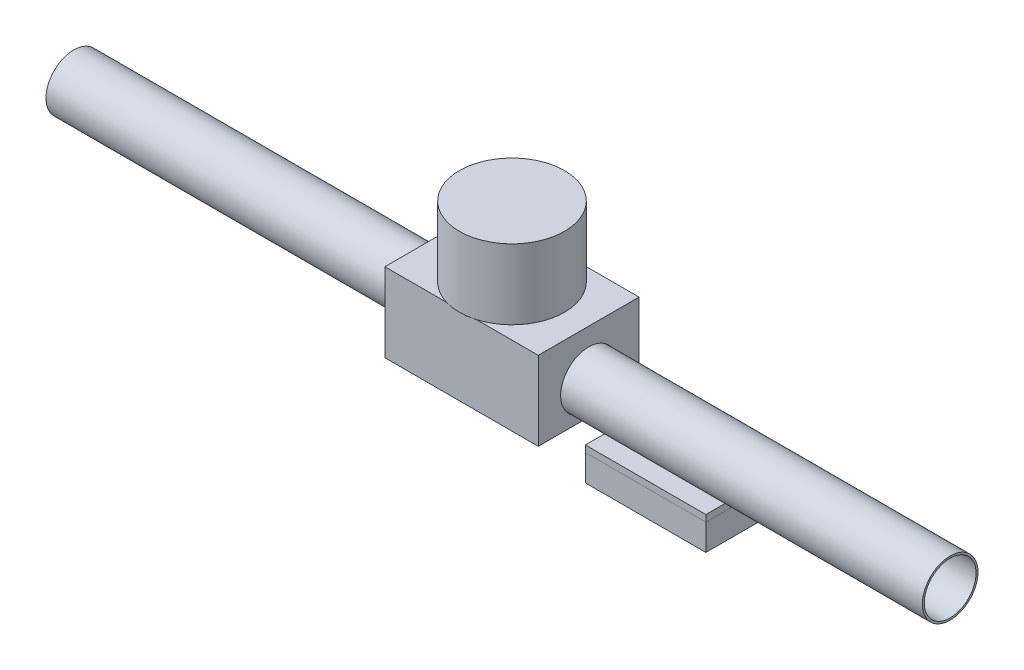
from build123d import *

# Parameters (mm, degrees)
SKETCH1_R   = 12.7
SKETCH1_R_2 = 11.811
BOOM_DEPTH  = 200
SKETCH2_W   = 46
SKETCH2_H   = 36
SKETCH2_R   = 12.8
MOUNT_DEPTH = 35
MOTOR_START = 21
SKETCH3_R   = 24
MOTOR_DEPTH = 32
PAD_START   = -12.7
SKETCH4_W   = 55
SKETCH4_H   = 28
PAD_DEPTH   = 3
ESC_START   = -15.7
SKETCH5_W   = 55
SKETCH5_H   = 28
ESC_DEPTH   = 12


with BuildPart() as part:
    # Sketch1 → Boom (new, symmetric)
    with BuildSketch(Plane(origin=(0, 0, 0), x_dir=(0, 0, -1), z_dir=(1, 0, 0))):
        Circle(SKETCH1_R)
        Circle(SKETCH1_R_2, mode=Mode.SUBTRACT)
    extrude(amount=BOOM_DEPTH, both=True)


with BuildPart() as body_2:
    # Sketch2 → Mount (new, symmetric)
    with BuildSketch(Plane(origin=(0, 0, 0), x_dir=(0, 0, -1), z_dir=(1, 0, 0))):
        with Locations((0, 3)):
            Rectangle(SKETCH2_W, SKETCH2_H)
        Circle(SKETCH2_R, mode=Mode.SUBTRACT)
    extrude(amount=MOUNT_DEPTH, both=True)


with BuildPart() as body_3:
    # Sketch3 → Motor (new body)
    with BuildSketch(Plane(origin=(0, 0, 0), x_dir=(1, 0, 0), z_dir=(0, 1, 0)).offset(MOTOR_START)):
        Circle(SKETCH3_R)
    extrude(amount=MOTOR_DEPTH)


with BuildPart() as body_4:
    # Sketch4 → Pad (new body)
    with BuildSketch(Plane(origin=(0, 0, 0), x_dir=(1, 0, 0), z_dir=(0, 1, 0)).offset(PAD_START)):
        with Locations((75, 0)):
            Rectangle(SKETCH4_W, SKETCH4_H)
    extrude(amount=-PAD_DEPTH)


with BuildPart() as body_5:
    # Sketch5 → ESC (new body)
    with BuildSketch(Plane(origin=(0, 0, 0), x_dir=(1, 0, 0), z_dir=(0, 1, 0)).offset(ESC_START)):
        with Locations((75, 0)):
            Rectangle(SKETCH5_W, SKETCH5_H)
    extrude(amount=-ESC_DEPTH)


solid = Compound([part.part, body_2.part, body_3.part, body_4.part, body_5.part])
